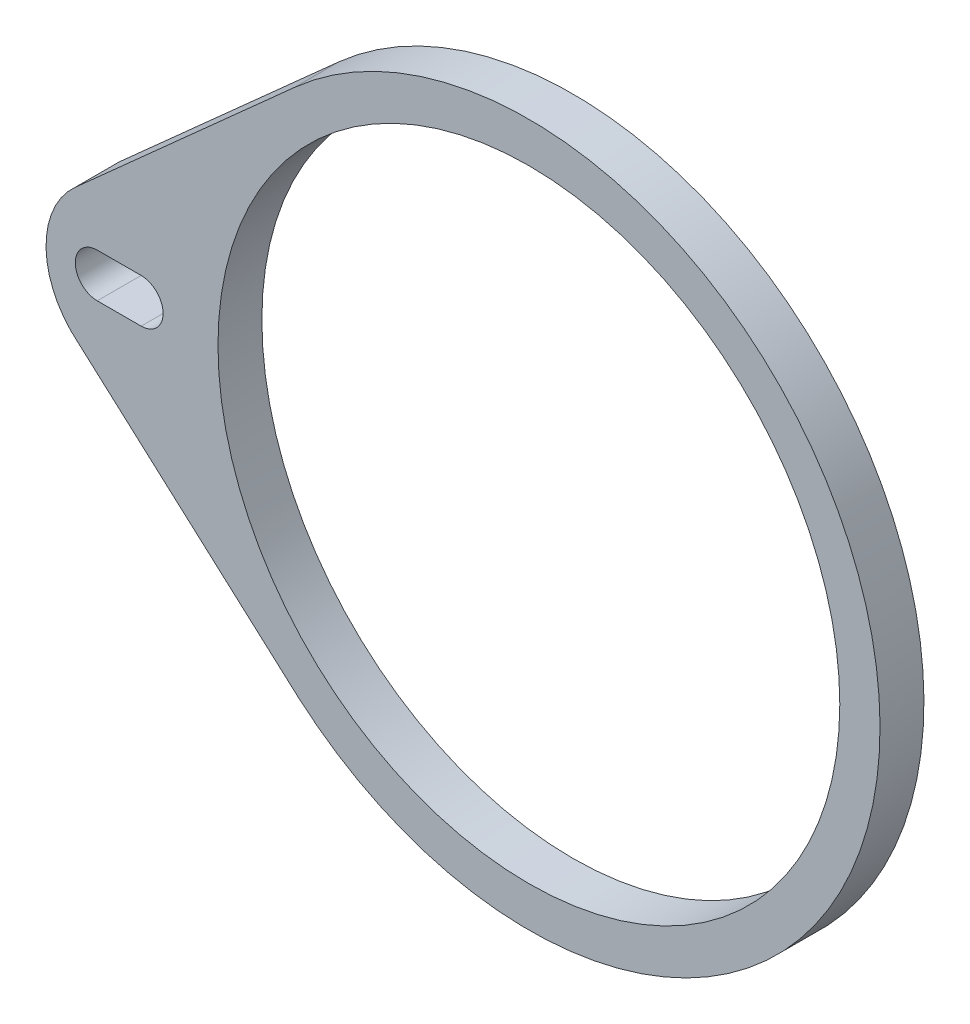
from build123d import *

# Parameters (mm, degrees)
EXTRUDE_1_DEPTH     = 3
SKETCH_2_R          = 21.25
CUT_EXTRUDE_1_DEPTH = 10


with BuildPart() as part:
    # 스케치1 → 보스-돌출1 (new body)
    with BuildSketch(Plane.XY):
        with BuildLine():
            Line((-16, 17.88854382), (-31, 4.472135955))
            ThreePointArc((-31, 4.472135955), (-32.997883626, -0.15934872), (-30.756898072, -4.678217276))
            Line((-30.756898072, -4.678217276), (-15.761131763, -18.099357048))
            ThreePointArc((-15.761131763, -18.099357048), (23.999471347, 0.159295521), (-16, 17.88854382))
        make_face()
    extrude(amount=EXTRUDE_1_DEPTH)

    # 스케치2 → 컷-돌출1 (cut)
    with BuildSketch(Plane(origin=(0, 0, 0), x_dir=(-1, 0, 0), z_dir=(0, 0, -1))):
        Circle(SKETCH_2_R)
        with BuildLine():
            Line((26.5, 1.5), (29.5, 1.5))
            ThreePointArc((29.5, 1.5), (31, 0), (29.5, -1.5))
            Line((29.5, -1.5), (26.5, -1.5))
            ThreePointArc((26.5, -1.5), (25, 0), (26.5, 1.5))
        make_face()
    extrude(amount=-CUT_EXTRUDE_1_DEPTH, mode=Mode.SUBTRACT)


solid = part.part
